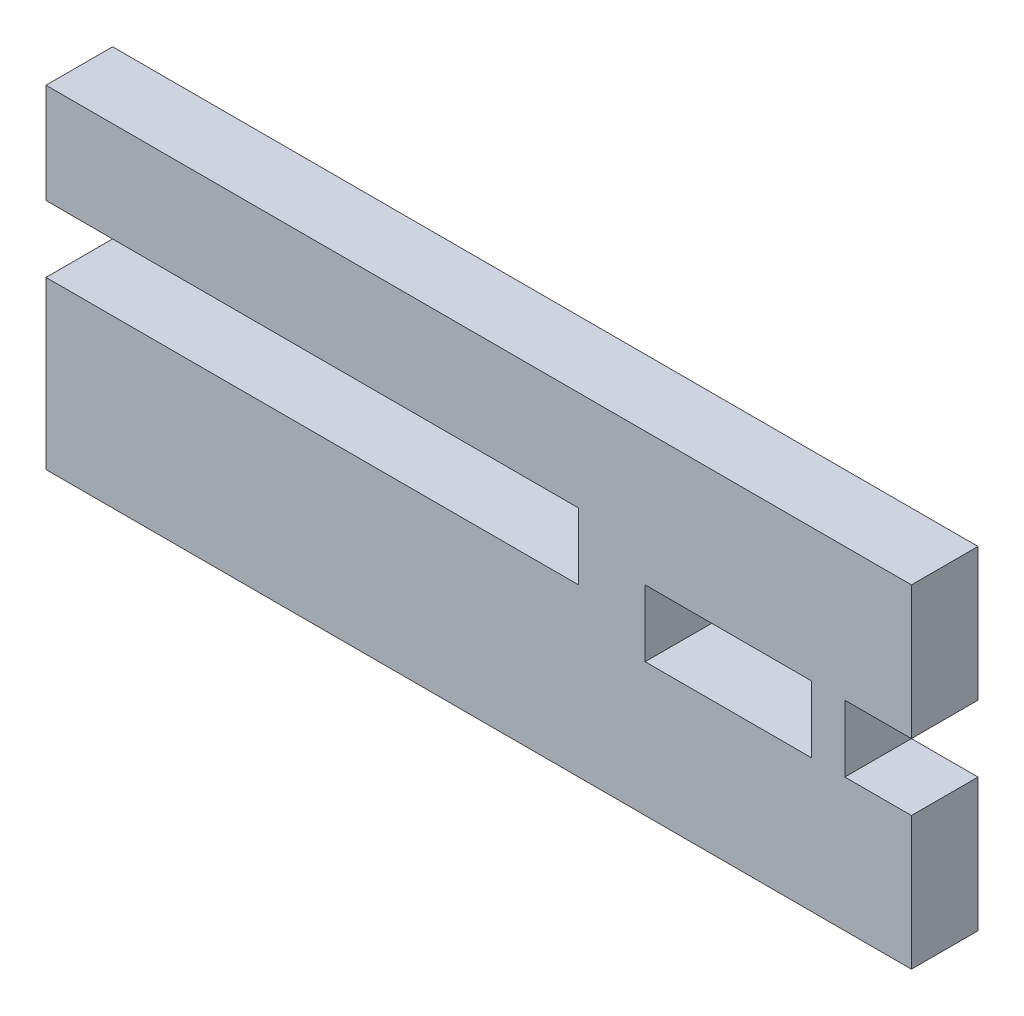
from build123d import *

# Parameters (mm, degrees)
SKETCH1_W           = 7.9375
SKETCH1_H           = 3.175
BOSS_EXTRUDE1_DEPTH = 3.175


with BuildPart() as part:
    # Sketch1 → Boss-Extrude1 (new body)
    with BuildSketch(Plane.XY):
        Polygon((0, 0), (41.275, 0), (41.275, 6.35), (38.1, 6.35), (38.1, 9.525), (41.275, 9.525), (41.275, 15.875), (0, 15.875), (0, 11.1125), (25.4, 11.1125), (25.4, 7.9375), (0, 7.9375), align=None)
        with Locations((32.54375, 7.9375)):
            Rectangle(SKETCH1_W, SKETCH1_H, mode=Mode.SUBTRACT)
    extrude(amount=BOSS_EXTRUDE1_DEPTH)


solid = part.part
